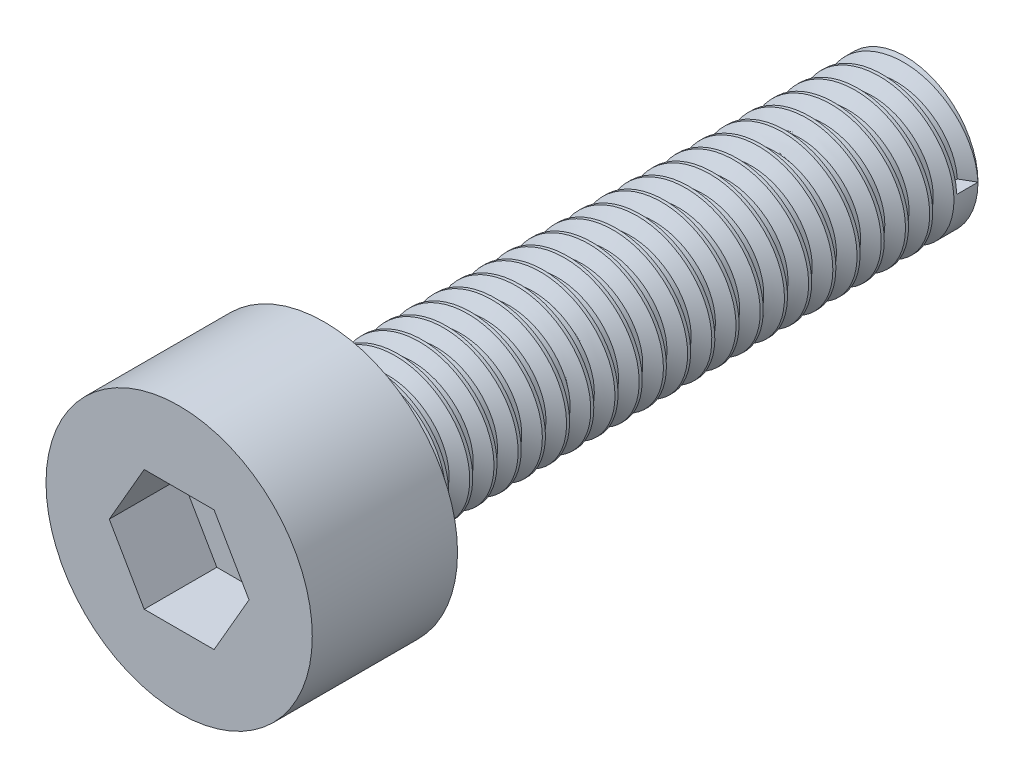
from build123d import *

# Parameters (mm, degrees)
SKETCH_1_R                = 1.5
EXTRUDE_3_10_DEPTH        = 12
M3X0_5_10_PITCH           = 0.5
SKETCH_2_R                = 2.75
EXTRUDE_5_5_3_DEPTH       = 3
CUT_EXTRUDE_2_5_1_5_DEPTH = 1.5


with BuildPart() as part:
    # Sketch 1 → 螺杆_直径3_长度10 (new body)
    with BuildSketch(Plane.XY):
        Circle(SKETCH_1_R)
    extrude(amount=EXTRUDE_3_10_DEPTH)

    # 真实螺纹_M3x0.5_右旋_长10: the profile of Sketch 1 2 profile screwed along a right-hand helix of 24 turns, 6 arcs to a turn; built about Z, then put on its axis
    m3x0_5_10_z = Axis((0, 0, 0), (0, 0, 1))
    m3x0_5_10_corners = [(1.5003, 0, -0.000173205), (1.5003, 0, 0.437673204), (1.229367063, 0, 0.281249999), (1.229367062, 0, 0.156249999)]
    with BuildLine(mode=Mode.PRIVATE) as m3x0_5_10_profile:
        Line(m3x0_5_10_corners[0], m3x0_5_10_corners[1])
        Line(m3x0_5_10_corners[1], m3x0_5_10_corners[2])
        Line(m3x0_5_10_corners[2], m3x0_5_10_corners[3])
        Line(m3x0_5_10_corners[3], m3x0_5_10_corners[0])
    m3x0_5_10_cap = Face(m3x0_5_10_profile.wire())
    m3x0_5_10_turn_angles = [0, 30, 60, 90, 120, 150, 180, 210, 240, 270, 300, 330, 360]
    m3x0_5_10_turn_weights = [1, 0.8660254037844387, 1, 0.8660254037844387, 1, 0.8660254037844387, 1, 0.8660254037844387, 1, 0.8660254037844387, 1, 0.8660254037844387, 1]
    m3x0_5_10_turn_rails = [Edge.make_bspline([Vector(p[0], p[1], 0).rotate(m3x0_5_10_z, m3x0_5_10_turn_angles[k]) / m3x0_5_10_turn_weights[k] + Vector(0, 0, p[2] + M3X0_5_10_PITCH * m3x0_5_10_turn_angles[k] / 360) for k in range(13)], [0, 0, 0, 1, 1, 2, 2, 3, 3, 4, 4, 5, 5, 6, 6, 6], 2, m3x0_5_10_turn_weights) for p in m3x0_5_10_corners]
    m3x0_5_10_turn_sides = [Face.make_surface_from_curves(m3x0_5_10_turn_rails[p[0]], m3x0_5_10_turn_rails[p[1]]) for p in [(0, 1), (1, 2), (2, 3), (3, 0)]]
    m3x0_5_10 = Plane(origin=(0, 0, 0), x_dir=(1, 0, 0), z_dir=(0, 0, 1)) * Solid(Shell([*[p.moved(Location((0, 0, M3X0_5_10_PITCH * i))) for i in range(24) for p in m3x0_5_10_turn_sides], m3x0_5_10_cap, m3x0_5_10_cap.rotate(m3x0_5_10_z, 8640).moved(Location((0, 0, M3X0_5_10_PITCH * 8640 / 360)))]))
    add(m3x0_5_10, mode=Mode.SUBTRACT)

    # 草图2 → 杯头_直径5.5_厚度3 (add)
    with BuildSketch(Plane.XY.offset(12)):
        Circle(SKETCH_2_R)
    extrude(amount=EXTRUDE_5_5_3_DEPTH)

    # 草图3 → 内六角_对边2.5_深1.5 (cut)
    with BuildSketch(Plane.XY.offset(15)):
        Polygon((1.443375673, 0), (0.721687836, 1.25), (-0.721687836, 1.25), (-1.443375673, 0), (-0.721687836, -1.25), (0.721687836, -1.25), align=None)
    extrude(amount=-CUT_EXTRUDE_2_5_1_5_DEPTH, mode=Mode.SUBTRACT)


solid = part.part
